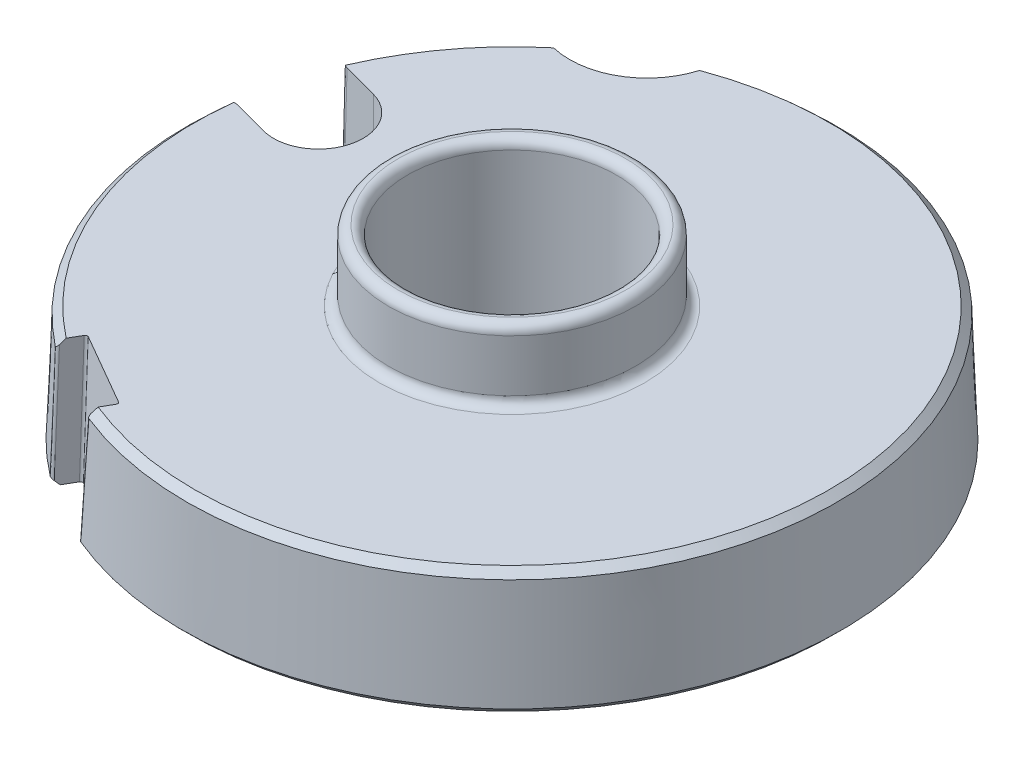
from build123d import *

# Parameters (mm, degrees)
SKETCH1_R           = 34.925
BOSS_EXTRUDE1_DEPTH = 13
BOSS_EXTRUDE1_TAPER = 2.21
CHAMFER1_SIZE       = 0.722669775
CHAMFER1_SIZE_2     = 0.75
CHAMFER1_SIZE_3     = 0.780685639
CUT_EXTRUDE1_DEPTH  = 13
CUT_EXTRUDE1_DRAFT  = -4.5
CUT_EXTRUDE2_DEPTH  = 13
CUT_EXTRUDE2_DRAFT  = -2.2
CUT_EXTRUDE4_DEPTH  = 17.5
FILLET1_R           = 0.25
SKETCH6_R           = 11.0625
CUT_EXTRUDE3_DEPTH  = 13
BOSS_EXTRUDE2_START = 7.5
SKETCH7_R           = 13.0625
SKETCH7_R_2         = 11.0625
BOSS_EXTRUDE2_DEPTH = 7.5
FILLET2_R           = 1


# Some blends are built 0.0001 mm under size
with BuildPart() as part:
    # Sketch1 → Boss-Extrude1 (new body)
    with BuildSketch(Plane(origin=(0, 0, 0), x_dir=(1, 0, 0), z_dir=(0, 1, 0))):
        Circle(SKETCH1_R)
    extrude(amount=BOSS_EXTRUDE1_DEPTH, taper=BOSS_EXTRUDE1_TAPER)

    # Chamfer1
    # the kernel refuses this chamfer: 0.780685639, 0.75, 0.722669775 mm, written as the material it takes off along each edge
    with BuildSketch(Plane(origin=(0, 0, 0), x_dir=(1, 0, 0), z_dir=(0, 0, 1))) as chamfer1_piece_1:
        Polygon((34.925 - CHAMFER1_SIZE * 0.038562212794, CHAMFER1_SIZE * 0.999256201571), (34.925 - CHAMFER1_SIZE_2, 0), (34.925, 0), align=None)
    revolve(axis=Axis((0, 0, 0), (0, 1, 0)), mode=Mode.SUBTRACT)
    with BuildSketch(Plane(origin=(0, 13, 0), x_dir=(1, 0, 0), z_dir=(0, 0, -1))) as chamfer1_piece_2:
        Polygon((34.423318083 + CHAMFER1_SIZE_2 * 0.0385622127818, CHAMFER1_SIZE_2 * 0.999256201254), (34.423318083 - CHAMFER1_SIZE_3, 0), (34.423318083, 0), align=None)
    revolve(axis=Axis((0, 13, 0), (0, -1, 0)), mode=Mode.SUBTRACT)


with BuildPart() as cut_extrude1_tool:
    # Sketch3 → Cut-Extrude1 (with draft: the straight prism first)
    with BuildSketch(Plane(origin=(0, 0, 0), x_dir=(1, 0, 0), z_dir=(0, 1, 0))):
        with BuildLine():
            ThreePointArc((-22.007744855, 27.11853225), (-15.962331288, 27.647568798), (-12.481465414, 32.61853225))
            ThreePointArc((-12.481465414, 32.61853225), (-17.4625, 30.245937227), (-22.007744855, 27.11853225))
        make_face()
    extrude(amount=CUT_EXTRUDE1_DEPTH)
    # Cut-Extrude1: the draft: its side faces are tilted about the plane it starts from
    cut_extrude1_sides = [cut_extrude1_tool.faces().sort_by_distance(p)[0] for p in [
        (-15.962331288, 6.5, -27.647568798),
        (-17.4625, 6.5, -30.245937227),
    ]]
    draft(cut_extrude1_sides, Plane(origin=(0, 0, 0), x_dir=(1, 0, 0), z_dir=(0, 1, 0)), CUT_EXTRUDE1_DRAFT)


with BuildPart() as part_1:
    add(part.part)

    # Cut-Extrude1: cut by cut_extrude1_tool
    add(cut_extrude1_tool.part, mode=Mode.SUBTRACT)


with BuildPart() as cut_extrude2_tool:
    # Sketch5 → Cut-Extrude2 (with draft: the straight prism first)
    with BuildSketch(Plane(origin=(0, 0, 0), x_dir=(1, 0, 0), z_dir=(0, 1, 0))):
        Polygon((-12.515145209, -29.926867367), (-19.659854791, -25.801867367), (-22.409854791, -30.565007088), (-15.265145209, -34.690007088), align=None)
    extrude(amount=CUT_EXTRUDE2_DEPTH)
    # Cut-Extrude2: the draft: its side faces are tilted about the plane it starts from
    cut_extrude2_sides = [cut_extrude2_tool.faces().sort_by_distance(p)[0] for p in [
        (-16.0875, 6.5, 27.864367367),
        (-21.034854791, 6.5, 28.183437227),
        (-18.8375, 6.5, 32.627507088),
        (-13.890145209, 6.5, 32.308437227),
    ]]
    draft(cut_extrude2_sides, Plane(origin=(0, 0, 0), x_dir=(1, 0, 0), z_dir=(0, 1, 0)), CUT_EXTRUDE2_DRAFT)


with BuildPart() as part_2:
    add(part_1.part)

    # Cut-Extrude2: cut by cut_extrude2_tool
    add(cut_extrude2_tool.part, mode=Mode.SUBTRACT)

    # Sketch8 → Cut-Extrude4 (cut)
    with BuildSketch(Plane.XZ):
        with BuildLine():
            Line((-26.782458498, -12.093899983), (-34.509865108, -14.164452344))
            ThreePointArc((-34.509865108, -14.164452344), (-40.327403248, -10.805695133), (-36.968646037, -4.988156994))
            Line((-36.968646037, -4.988156994), (-29.241239427, -2.917604633))
            ThreePointArc((-29.241239427, -2.917604633), (-23.423701288, -6.276361844), (-26.782458498, -12.093899983))
        make_face()
    extrude(amount=-CUT_EXTRUDE4_DEPTH, mode=Mode.SUBTRACT)

    # Fillet1
    fillet1_edges = [part_2.edges().sort_by_distance(p)[0] for p in [
        (-12.174042092, 6.5, 29.835469062),
        (-19.751253095, 6.5, 25.46076425),
        (-13.410686626, 6.486385182, 31.976354169),
        (-20.986991717, 6.486385182, 27.602172385),
        (-22.192531964, 6.486342052, -26.642548455),
        (-11.976857671, 6.486342043, -32.54057076),
    ]]
    fillet(fillet1_edges, radius=FILLET1_R)

    # Sketch6 → Cut-Extrude3 (cut)
    with BuildSketch(Plane(origin=(0, 13, 0), x_dir=(1, 0, 0), z_dir=(0, 1, 0))):
        with Locations(Location((0, 0, 0), (0, 0, 270))):
            Circle(SKETCH6_R)
    extrude(amount=-CUT_EXTRUDE3_DEPTH, mode=Mode.SUBTRACT)

    # Sketch7 → Boss-Extrude2 (add)
    with BuildSketch(Plane(origin=(0, 13, 0), x_dir=(1, 0, 0), z_dir=(0, 1, 0)).offset(BOSS_EXTRUDE2_START)):
        with Locations(Location((0, 0, 0), (0, 0, 270))):
            Circle(SKETCH7_R)
        with Locations(Location((0, 0, 0), (0, 0, 270))):
            Circle(SKETCH7_R_2, mode=Mode.SUBTRACT)
    extrude(amount=-BOSS_EXTRUDE2_DEPTH)

    # Fillet2
    fillet2_edges = [part_2.edges().sort_by_distance(p)[0] for p in [
        (0, 20.5, -11.0625),
        (0, 20.5, -13.0625),
        (0, 13, -13.0625),
        (-34.406108256, 6.505188254, -4.301527065),
        (-31.947327327, 6.505188254, -13.477822415),
    ]]
    fillet(fillet2_edges, radius=FILLET2_R - 0.0001)  # a hair under: the kernel refuses the full size


solid = part_2.part
